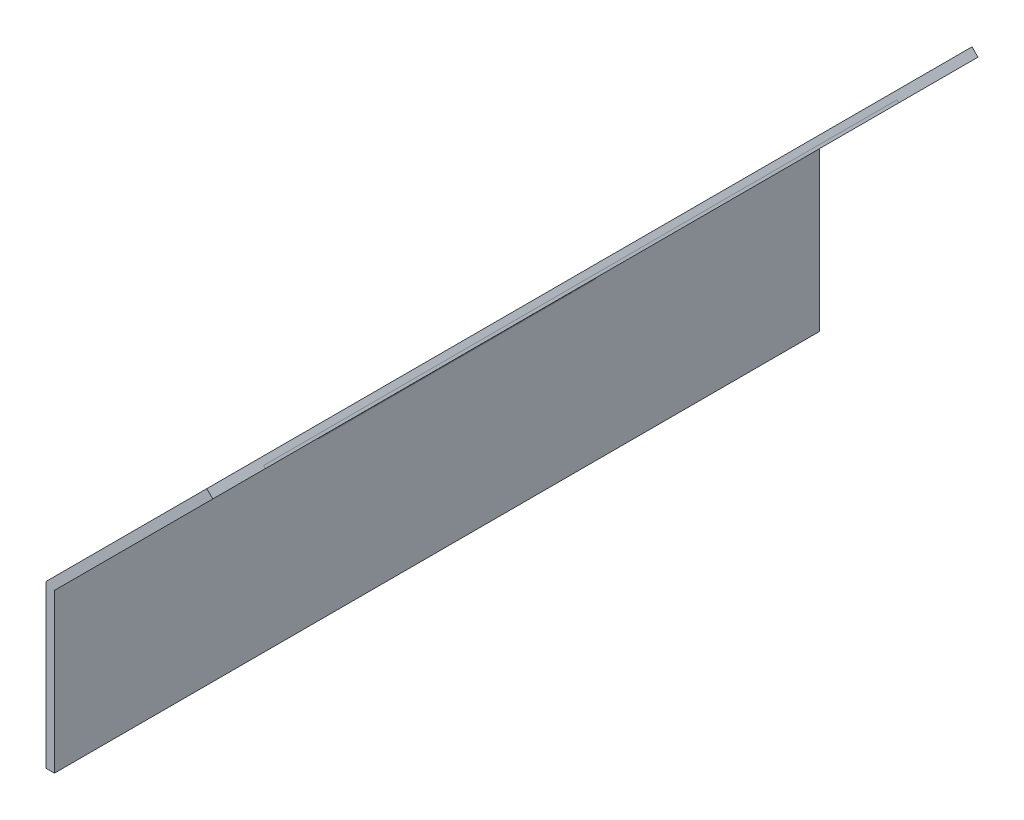
from build123d import *

# Parameters (mm, degrees)
BOSS_EXTRUDE2_DEPTH  = 368.3
CONVERT_SOLID2_START = -368.3
CONVERT_SOLID2_DEPTH = 368.3
SKETCH12_W           = 127
SKETCH12_H           = 76.571974388
CUT_EXTRUDE1_DEPTH   = 292.1
SKETCH13_W           = 31.75
SKETCH13_H           = 76.571974388
CUT_EXTRUDE2_DEPTH   = 292.1
SKETCH14_R           = 3.2639
CUT_EXTRUDE3_DEPTH   = 292.1
SKETCH16_W           = 38.1
SKETCH16_H           = 76.686538097
CUT_EXTRUDE4_DEPTH   = 428.7622778
SKETCH17_W           = 125.224844509
SKETCH17_H           = 76.571974388
CUT_EXTRUDE5_DEPTH   = 428.7622778
SKETCH18_W           = 25.4
SKETCH18_H           = 153.258512485
CUT_EXTRUDE6_DEPTH   = 428.7622778


# Read off the part's stored shape, not the designer's step: Convert-Solid2
with BuildPart() as part:
    # Sketch7 → Boss-Extrude2 (new body)
    with BuildSketch(Plane.XY):
        Polygon((0, 0), (4.064, 0), (4.064, 76.2), (80.264, 152.4), (77.390318041, 155.273681959), (77.208487056, 155.091850973), (0, 77.883363917), align=None)
    extrude(amount=-BOSS_EXTRUDE2_DEPTH)


with BuildPart() as body_2:
    # Convert-Solid2 outline → Convert-Solid2 (new body)
    with BuildSketch(Plane.XY.offset(CONVERT_SOLID2_START)):
        with BuildLine():
            Line((2.84988, 0), (4.064, 0))
            Line((4.064, 0), (4.064, 75.673948776))
            ThreePointArc((4.064, 75.673948776), (4.160672994, 76.159956735), (4.435974388, 76.571974388))
            Line((4.435974388, 76.571974388), (80.264, 152.4))
            Line((80.264, 152.4), (79.405487515, 153.258512485))
            Line((79.405487515, 153.258512485), (3.577461903, 77.430486873))
            ThreePointArc((3.577461903, 77.430486873), (3.038972376, 76.624580344), (2.84988, 75.673948776))
            Line((2.84988, 75.673948776), (2.84988, 0))
        make_face()
    extrude(amount=CONVERT_SOLID2_DEPTH)

    # Sketch12 → Cut-Extrude1 (cut)
    with BuildSketch(Plane(origin=(152.4, 0, 0), x_dir=(0, 0, -1), z_dir=(1, 0, 0))):
        with Locations((63.5, 38.285987194)):
            Rectangle(SKETCH12_W, SKETCH12_H)
    extrude(amount=-CUT_EXTRUDE1_DEPTH, mode=Mode.SUBTRACT)

    # Sketch13 → Cut-Extrude2 (cut)
    with BuildSketch(Plane(origin=(152.4, 0, 0), x_dir=(0, 0, -1), z_dir=(1, 0, 0))):
        with Locations((276.225, 38.285987194)):
            Rectangle(SKETCH13_W, SKETCH13_H)
    extrude(amount=-CUT_EXTRUDE2_DEPTH, mode=Mode.SUBTRACT)

    # Sketch14 → Cut-Extrude3 (cut)
    with BuildSketch(Plane.ZY.offset(-2.84988)):
        with Locations(Location((-247.65, 12.7, 0), (0, 0, 270))):
            Circle(SKETCH14_R)
        with Locations(Location((-139.7, 12.7, 0), (0, 0, 270))):
            Circle(SKETCH14_R)
    extrude(amount=-CUT_EXTRUDE3_DEPTH, mode=Mode.SUBTRACT)

    # Sketch16 → Cut-Extrude4 (cut, through all)
    with BuildSketch(Plane(origin=(152.4, 0, 0), x_dir=(0, 0, -1), z_dir=(1, 0, 0))):
        with Locations((349.25, 114.915243437)):
            Rectangle(SKETCH16_W, SKETCH16_H)
    extrude(amount=-CUT_EXTRUDE4_DEPTH, mode=Mode.SUBTRACT)

    # Sketch17 → Cut-Extrude5 (cut, through all)
    with BuildSketch(Plane(origin=(152.4, 0, 0), x_dir=(0, 0, -1), z_dir=(1, 0, 0))):
        with Locations((322.962422254, 38.285987194)):
            Rectangle(SKETCH17_W, SKETCH17_H)
    extrude(amount=-CUT_EXTRUDE5_DEPTH, mode=Mode.SUBTRACT)

    # Sketch18 → Cut-Extrude6 (cut, through all)
    with BuildSketch(Plane(origin=(152.4, 0, 0), x_dir=(0, 0, -1), z_dir=(1, 0, 0))):
        with Locations((12.7, 76.629256243)):
            Rectangle(SKETCH18_W, SKETCH18_H)
    extrude(amount=-CUT_EXTRUDE6_DEPTH, mode=Mode.SUBTRACT)


solid = Compound([part.part, body_2.part])
